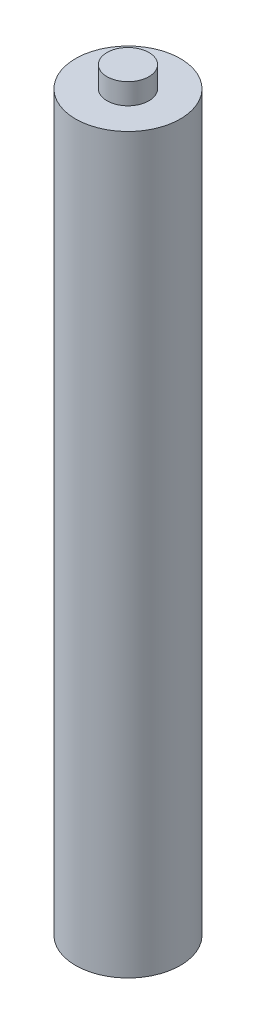
from build123d import *

# Parameters (mm, degrees)
SKETCH1_R           = 12.7
BOSS_EXTRUDE1_DEPTH = 177.8
SKETCH4_R           = 5.08
BOSS_EXTRUDE2_DEPTH = 5.08


with BuildPart() as part:
    # Sketch1 → Boss-Extrude1 (new body)
    with BuildSketch(Plane(origin=(0, 0, 0), x_dir=(1, 0, 0), z_dir=(0, 1, 0))):
        Circle(SKETCH1_R)
    extrude(amount=BOSS_EXTRUDE1_DEPTH)

    # Sketch4 → Boss-Extrude2 (add)
    with BuildSketch(Plane(origin=(0, 177.8, 0), x_dir=(1, 0, 0), z_dir=(0, 1, 0))):
        Circle(SKETCH4_R)
    extrude(amount=BOSS_EXTRUDE2_DEPTH)


solid = part.part
